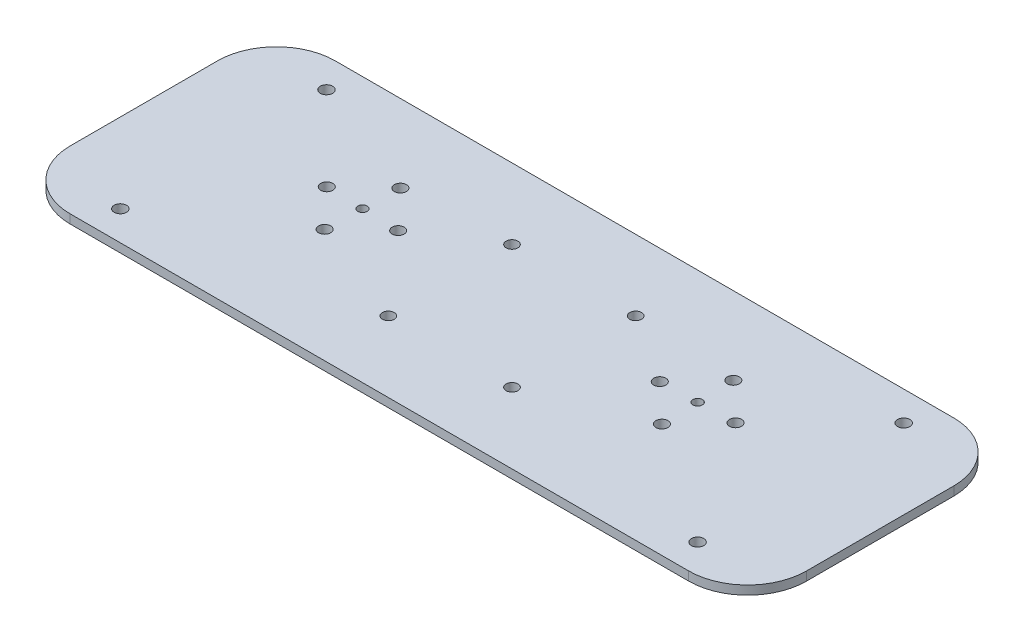
from build123d import *

# Parameters (mm, degrees)
SKETCH_1_W          = 250
SKETCH_1_H          = 3
EXTRUDE_1_DEPTH     = 45
SKETCH_2_R          = 2
CUT_EXTRUDE_1_DEPTH = 133.887170186
FILLET_1_R          = 20
SKETCH_4_R          = 2.1
CUT_EXTRUDE_3_DEPTH = 10
SKETCH_5_R          = 2.05
CUT_EXTRUDE_4_DEPTH = 4
SKETCH_6_R          = 1.6
CUT_EXTRUDE_5_DEPTH = 4


with BuildPart() as part:
    # 草图1 → 凸台-拉伸1 (new, symmetric)
    with BuildSketch(Plane.XY):
        Rectangle(SKETCH_1_W, SKETCH_1_H)
    extrude(amount=EXTRUDE_1_DEPTH, both=True)

    # 草图2 → 切除-拉伸1 (cut, through all)
    with BuildSketch(Plane(origin=(0, 1.5, 0), x_dir=(1, 0, 0), z_dir=(0, 1, 0))):
        with Locations((-21, 21)):
            Circle(SKETCH_2_R)
        with Locations((21, 21)):
            Circle(SKETCH_2_R)
        with Locations((21, -21)):
            Circle(SKETCH_2_R)
        with Locations((-21, -21)):
            Circle(SKETCH_2_R)
    extrude(amount=-CUT_EXTRUDE_1_DEPTH, mode=Mode.SUBTRACT)

    # 圆角1
    fillet_1_edges = [part.edges().sort_by_distance(p)[0] for p in [
        (125, 0, 45),
        (-125, 0, 45),
        (-125, 0, -45),
        (125, 0, -45),
    ]]
    fillet(fillet_1_edges, radius=FILLET_1_R)

    # 草图4 → 切除-拉伸3 (cut)
    with BuildSketch(Plane.XZ.offset(1.5)):
        with Locations((-98, -35)):
            Circle(SKETCH_4_R)
        with Locations((-98, 35)):
            Circle(SKETCH_4_R)
        with Locations((98, 35)):
            Circle(SKETCH_4_R)
        with Locations((98, -35)):
            Circle(SKETCH_4_R)
    extrude(amount=-CUT_EXTRUDE_3_DEPTH, mode=Mode.SUBTRACT)

    # 草图5 → 切除-拉伸4 (cut)
    with BuildSketch(Plane.XZ.offset(1.5)):
        with Locations((57.273087281, 6.359345731)):
            Circle(SKETCH_5_R)
        with Locations((69.398377233, -6.504454003)):
            Circle(SKETCH_5_R)
        with Locations((44.409287547, -5.765944221)):
            Circle(SKETCH_5_R)
        with Locations((56.534577499, -18.629743954)):
            Circle(SKETCH_5_R)
    cut_extrude_4 = extrude(amount=-CUT_EXTRUDE_4_DEPTH, mode=Mode.SUBTRACT)

    # 草图6 → 切除-拉伸5 (cut)
    with BuildSketch(Plane(origin=(0, 1.5, 0), x_dir=(1, 0, 0), z_dir=(0, 1, 0))):
        with Locations((56.90383239, 6.135199112)):
            Circle(SKETCH_6_R)
    cut_extrude_5 = extrude(amount=-CUT_EXTRUDE_5_DEPTH, mode=Mode.SUBTRACT)

    # 镜向1: 切除-拉伸4, 切除-拉伸5 across plane
    add(cut_extrude_4.mirror(Plane(origin=(0, 0, 0), x_dir=(0, 0, 1), z_dir=(1, 0, 0))), mode=Mode.SUBTRACT)
    add(cut_extrude_5.mirror(Plane(origin=(0, 0, 0), x_dir=(0, 0, 1), z_dir=(1, 0, 0))), mode=Mode.SUBTRACT)


solid = part.part
